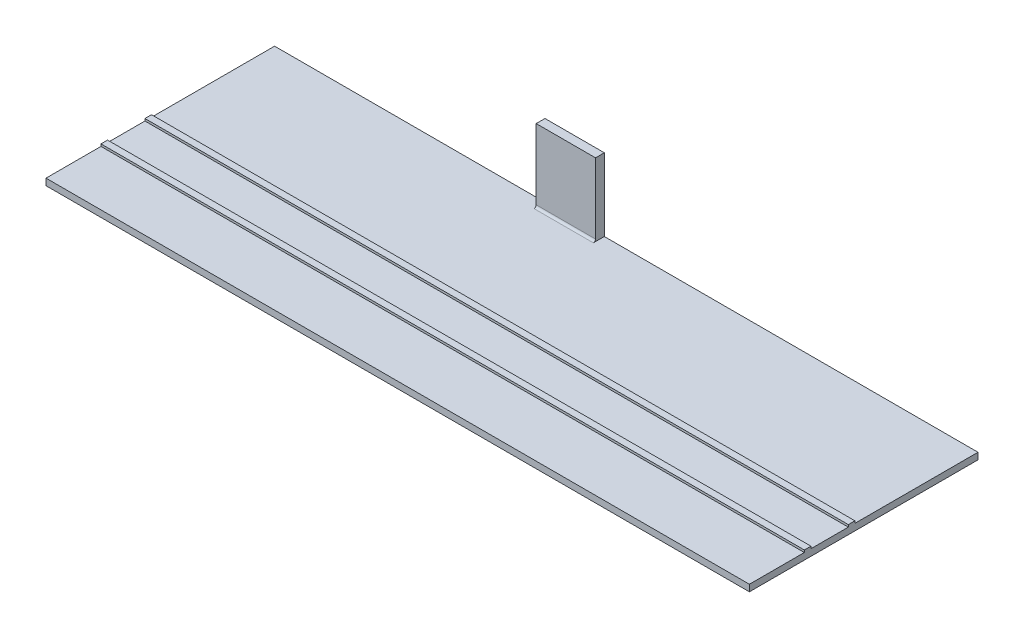
from build123d import *

# Parameters (mm, degrees)
SCHIZZO1_W                        = 27
SCHIZZO1_H                        = 36
ESTRUSIONE_ESTRUSIONE1_DEPTH      = 4
SCHIZZO3_W                        = 27
SCHIZZO3_H                        = 3
ESTRUSIONE_ESTRUSIONE2_DEPTH      = 100
RACCORDO1_R                       = 1
ESTRUSIONE_ESTRUSIONE3_DEPTH      = 170
ESTRUSIONE_ESTRUSIONE3_DEPTH_BACK = 150
SCHIZZO5_W                        = 104
SCHIZZO5_H                        = 3
SCHIZZO6_W                        = 3
SCHIZZO6_H                        = 1
ESTRUSIONE_ESTRUSIONE4_DEPTH      = 320


with BuildPart() as part:
    # Schizzo1 → Estrusione-Estrusione1 (new body)
    with BuildSketch(Plane.XY):
        with Locations((13.5, -18)):
            Rectangle(SCHIZZO1_W, SCHIZZO1_H)
    extrude(amount=ESTRUSIONE_ESTRUSIONE1_DEPTH)

    # Schizzo3 → Estrusione-Estrusione2 (add)
    with BuildSketch(Plane.XY.offset(4)):
        with Locations((13.5, -34.5)):
            Rectangle(SCHIZZO3_W, SCHIZZO3_H)
    extrude(amount=ESTRUSIONE_ESTRUSIONE2_DEPTH)

    # Raccordo1
    raccordo1_edges = [part.edges().sort_by_distance(p)[0] for p in [
        (13.5, -33, 4),
    ]]
    fillet(raccordo1_edges, radius=RACCORDO1_R)

    # Schizzo5 → Estrusione-Estrusione3 (add, two sides: drawn at the far end of the back side and taken through both)
    with BuildSketch(Plane(origin=(27, 0, 0), x_dir=(0, 0, -1), z_dir=(1, 0, 0)).offset(-ESTRUSIONE_ESTRUSIONE3_DEPTH_BACK)):
        with Locations((-52, -34.5)):
            Rectangle(SCHIZZO5_W, SCHIZZO5_H)
    extrude(amount=ESTRUSIONE_ESTRUSIONE3_DEPTH + ESTRUSIONE_ESTRUSIONE3_DEPTH_BACK)

    # Schizzo6 → Estrusione-Estrusione4 (add)
    with BuildSketch(Plane.ZY.offset(123)):
        with Locations((77.5, -32.5)):
            Rectangle(SCHIZZO6_W, SCHIZZO6_H)
        with Locations((57.5, -32.5)):
            Rectangle(SCHIZZO6_W, SCHIZZO6_H)
    extrude(amount=-ESTRUSIONE_ESTRUSIONE4_DEPTH)


solid = part.part
